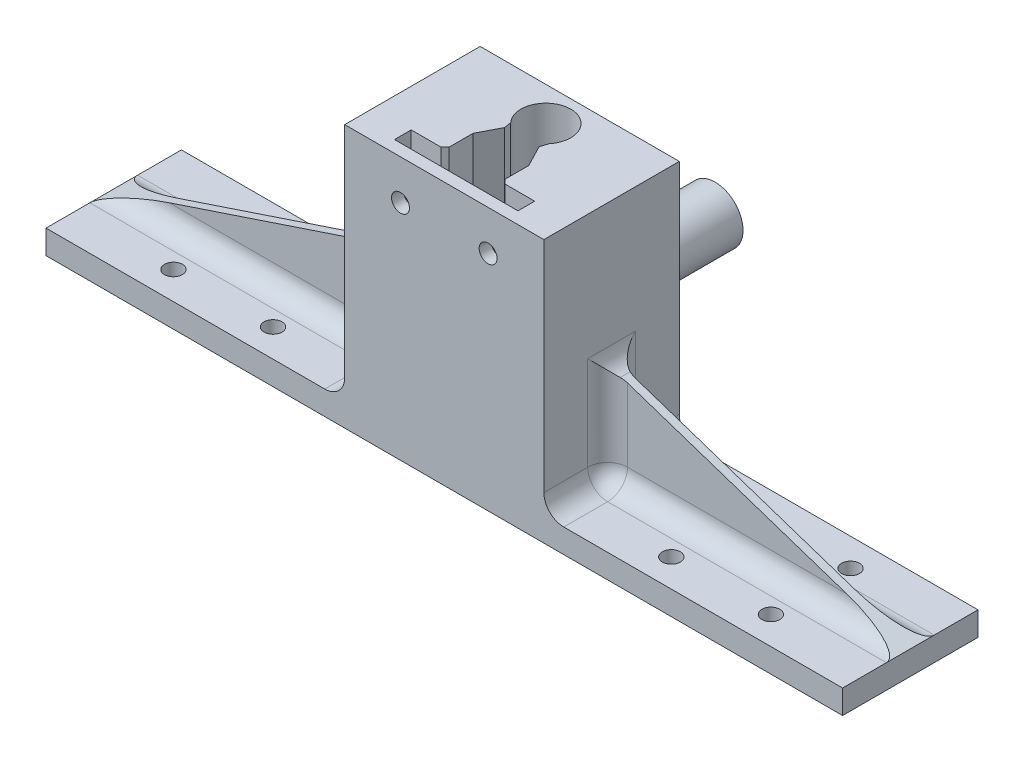
from build123d import *

# Parameters (mm, degrees)
SKETCH1_W               = 50
SKETCH1_H               = 34
BOSS_EXTRUDE1_DEPTH     = 60
CUT_EXTRUDE1_DEPTH      = 68.186308129
SKETCH3_R               = 2.25
CUT_EXTRUDE2_DEPTH      = 74.35529974
CUT_EXTRUDE3_DEPTH      = 24.8
CHAMFER1_SIZE           = 1
CHAMFER1_SIZE_2         = 1.220120443
SKETCH5_W               = 200
SKETCH5_H               = 34
BOSS_EXTRUDE2_DEPTH     = 6
BOSS_EXTRUDE3_DEPTH     = 1
FILLET1_R               = 5
FILLET2_R               = 5
SKETCH7_R               = 2.25
CUT_EXTRUDE4_DEPTH      = 4
SKETCH8_R               = 2.25
CUT_EXTRUDE5_DEPTH      = 119.882294729
LPATTERN1_COUNT         = 2
LPATTERN1_PITCH         = 25
MIRROR4_COPY_1_SKETCH_R = 2.25
MIRROR4_COPY_1_DEPTH    = 4
MIRROR4_COPY_2_SKETCH_R = 2.25
MIRROR4_COPY_2_DEPTH    = 119.882294729
CUT_EXTRUDE6_DEPTH      = 4
SKETCH10_R              = 7
BOSS_EXTRUDE4_DEPTH     = 14
SKETCH11_R              = 7
SKETCH11_R_2            = 4.15
BOSS_EXTRUDE5_DEPTH     = 20
CHAMFER2_SIZE           = 10
CHAMFER2_SIZE2          = 0.174550649
CHAMFER3_SIZE           = 10


with BuildPart() as part:
    # Sketch1 → Boss-Extrude1 (new body)
    with BuildSketch(Plane(origin=(0, 0, 0), x_dir=(1, 0, 0), z_dir=(0, 1, 0))):
        Rectangle(SKETCH1_W, SKETCH1_H)
    extrude(amount=BOSS_EXTRUDE1_DEPTH)

    # Sketch2 → Cut-Extrude1 (cut, through all)
    with BuildSketch(Plane(origin=(0, 60, 0), x_dir=(1, 0, 0), z_dir=(0, 1, 0))):
        with BuildLine():
            Line((-3.75, 3.5), (-7, -2.8))
            Line((-7, -2.8), (-7, -9.8))
            Line((-7, -9.8), (-15.5, -9.8))
            Line((-15.5, -9.8), (-15.5, -14))
            Line((-15.5, -14), (15.5, -14))
            Line((15.5, -14), (15.5, -9.8))
            Line((15.5, -9.8), (7, -9.8))
            Line((7, -9.8), (7, -2.8))
            Line((7, -2.8), (3.75, 3.5))
            ThreePointArc((3.75, 3.5), (0, 14.75), (-3.75, 3.5))
        make_face()
    extrude(amount=-CUT_EXTRUDE1_DEPTH, mode=Mode.SUBTRACT)

    # Sketch3 → Cut-Extrude2 (cut, through all)
    with BuildSketch(Plane.XY.offset(17)):
        with Locations((-11, 50)):
            Circle(SKETCH3_R)
        with Locations((11, 50)):
            Circle(SKETCH3_R)
    extrude(amount=-CUT_EXTRUDE2_DEPTH, mode=Mode.SUBTRACT)

    # Sketch4 → Cut-Extrude3 (cut)
    with BuildSketch(Plane(origin=(0, 0, -17), x_dir=(-1, 0, 0), z_dir=(0, 0, -1))):
        Polygon((14.75, 52.165063509), (11, 54.330127019), (7.25, 52.165063509), (7.25, 47.834936491), (11, 45.669872981), (14.75, 47.834936491), align=None)
        Polygon((-7.25, 47.834936491), (-7.25, 52.165063509), (-11, 54.330127019), (-14.75, 52.165063509), (-14.75, 47.834936491), (-11, 45.669872981), align=None)
    extrude(amount=-CUT_EXTRUDE3_DEPTH, mode=Mode.SUBTRACT)

    # Chamfer1
    # the kernel refuses this chamfer: 1.220120443, 1 mm, written as the material it takes off along each edge
    with BuildSketch(Plane(origin=(-7, 62.571682988, 9.8), x_dir=(-1, 0, 0), z_dir=(0, -1, 0)), Plane(origin=(7, 62.571682988, 9.8), x_dir=(0, 0, -1), z_dir=(0, -1, 0))) as chamfer1_piece_1:
        Polygon((CHAMFER1_SIZE, 0), (0, CHAMFER1_SIZE), (0, 0), align=None)
    extrude(amount=65.143365976, mode=Mode.SUBTRACT)
    with BuildSketch(Plane(origin=(-3.75, 63.150527813, -3.5), x_dir=(-0.45846324589157744, 0, 0.8887133689590581), z_dir=(0, -1, 0))) as chamfer1_piece_2:
        with BuildLine():
            Line((CHAMFER1_SIZE_2, 0), (-0.278286757, 1.065574765))
            ThreePointArc((-0.278286757, 1.065574765), (-0.120412167, 0.557139368), (0, 0))
            Line((0, 0), (CHAMFER1_SIZE_2, 0))
        make_face()
    extrude(amount=66.301055626, mode=Mode.SUBTRACT)
    with BuildSketch(Plane(origin=(3.75, 63.795705698, -3.5), x_dir=(0.7235959376340886, 0, -0.6902238180760238), z_dir=(0, -1, 0))) as chamfer1_piece_3:
        with BuildLine():
            Line((1.475268649, 0), (-CHAMFER1_SIZE * 0.281668992416, CHAMFER1_SIZE * 0.959511635527))
            Line((-CHAMFER1_SIZE * 0.281668992416, CHAMFER1_SIZE * 0.959511635527), (0, 0))
            ThreePointArc((0, 0), (0.759242358, 0.043643641), (1.475268649, 0))
        make_face()
    extrude(amount=67.591411396, mode=Mode.SUBTRACT)

    # Sketch5 → Boss-Extrude2 (add)
    with BuildSketch(Plane.XZ):
        Rectangle(SKETCH5_W, SKETCH5_H)
    extrude(amount=BOSS_EXTRUDE2_DEPTH)

    # Sketch6 → Boss-Extrude3 (add, symmetric)
    with BuildSketch(Plane.XY):
        Polygon((-100, 0), (-25, 25), (-25, 0), align=None)
    boss_extrude3 = extrude(amount=BOSS_EXTRUDE3_DEPTH, both=True)

    # Mirror3: Boss-Extrude3 across plane
    add(boss_extrude3.mirror(Plane(origin=(0, 0, 0), x_dir=(0, 0, 1), z_dir=(1, 0, 0))))

    # Fillet1
    # the kernel refuses this fillet: 5 mm, written as the material it adds along each edge
    with BuildSketch(Plane(origin=(-12.5, 0, -1), x_dir=(0, 0, -1), z_dir=(-1, 0, 0))) as fillet1_piece_1_section:
        with BuildLine():
            CenterArc((FILLET1_R, -FILLET1_R), FILLET1_R, 90, 90)
            Line((0, -FILLET1_R), (0, 0))
            Line((0, 0), (FILLET1_R, 0))
        make_face()
    fillet1_piece_1 = extrude(amount=87.5, mode=Mode.PRIVATE)
    fillet1_piece_1 = split(fillet1_piece_1, bisect_by=Plane(origin=(-21.25, 26.25, -1), z_dir=(0.31622776601683794, -0.9486832980505139, 0)), keep=Keep.TOP, mode=Mode.PRIVATE)
    add(fillet1_piece_1)
    with BuildSketch(Plane(origin=(-12.5, 0, 1), x_dir=(0, 0, 1), z_dir=(-1, 0, 0))) as fillet1_piece_2_section:
        with BuildLine():
            CenterArc((FILLET1_R, FILLET1_R), FILLET1_R, 180, 90)
            Line((0, FILLET1_R), (0, 0))
            Line((0, 0), (FILLET1_R, 0))
        make_face()
    fillet1_piece_2 = extrude(amount=87.5, mode=Mode.PRIVATE)
    fillet1_piece_2 = split(fillet1_piece_2, bisect_by=Plane(origin=(-21.25, 26.25, 1), z_dir=(0.31622776601683794, -0.9486832980505139, 0)), keep=Keep.TOP, mode=Mode.PRIVATE)
    add(fillet1_piece_2)
    with BuildSketch(Plane(origin=(12.5, 0, 1), x_dir=(0, 0, 1), z_dir=(1, 0, 0))) as fillet1_piece_3_section:
        with BuildLine():
            CenterArc((FILLET1_R, -FILLET1_R), FILLET1_R, 90, 90)
            Line((0, -FILLET1_R), (0, 0))
            Line((0, 0), (FILLET1_R, 0))
        make_face()
    fillet1_piece_3 = extrude(amount=87.5, mode=Mode.PRIVATE)
    fillet1_piece_3 = split(fillet1_piece_3, bisect_by=Plane(origin=(21.25, 26.25, 1), z_dir=(-0.31622776601683794, -0.9486832980505139, 0)), keep=Keep.TOP, mode=Mode.PRIVATE)
    add(fillet1_piece_3)
    with BuildSketch(Plane(origin=(12.5, 0, -1), x_dir=(0, 0, -1), z_dir=(1, 0, 0))) as fillet1_piece_4_section:
        with BuildLine():
            CenterArc((FILLET1_R, FILLET1_R), FILLET1_R, 180, 90)
            Line((0, FILLET1_R), (0, 0))
            Line((0, 0), (FILLET1_R, 0))
        make_face()
    fillet1_piece_4 = extrude(amount=87.5, mode=Mode.PRIVATE)
    fillet1_piece_4 = split(fillet1_piece_4, bisect_by=Plane(origin=(21.25, 26.25, -1), z_dir=(-0.31622776601683794, -0.9486832980505139, 0)), keep=Keep.TOP, mode=Mode.PRIVATE)
    add(fillet1_piece_4)

    # Fillet2
    fillet2_edges = [part.edges().sort_by_distance(p)[0] for p in [
        (-25, 25, 0),
        (25, 25, 0),
        (25, 15, -1),
        (25, 0, -11.5),
        (25, 15, 1),
        (25, 1.464466094, 2.464466094),
        (25, 1.464466094, -2.464466094),
        (-25, 15, -1),
        (-25, 15, 1),
        (-25, 0, 11.5),
        (-25, 1.464466094, 2.464466094),
        (-25, 1.464466094, -2.464466094),
        (25, 0, 11.5),
        (-25, 0, -11.5),
    ]]
    fillet(fillet2_edges, radius=FILLET2_R)

    # Sketch7 → Cut-Extrude4 (cut)
    with BuildSketch(Plane.XZ.offset(6)):
        with Locations(Location((-75, 10, 0), (0, 0, 270))):
            Circle(SKETCH7_R)
        with Locations(Location((-75, -10, 0), (0, 0, 270))):
            Circle(SKETCH7_R)
    cut_extrude4 = extrude(amount=-CUT_EXTRUDE4_DEPTH, mode=Mode.SUBTRACT)

    # Sketch8 → Cut-Extrude5 (cut, through all)
    with BuildSketch(Plane(origin=(0, -2, 0), x_dir=(-1, 0, 0), z_dir=(0, -1, 0))):
        with Locations(Location((75, -10, 0), (0, 0, 90))):
            Circle(SKETCH8_R)
        with Locations(Location((75, 10, 0), (0, 0, 90))):
            Circle(SKETCH8_R)
    cut_extrude5 = extrude(amount=-CUT_EXTRUDE5_DEPTH, mode=Mode.SUBTRACT)

    # LPattern1: Cut-Extrude4, Cut-Extrude5 ×2
    with Locations(*[(i * LPATTERN1_PITCH, 0, 0) for i in range(1, LPATTERN1_COUNT)]):
        add(cut_extrude4, mode=Mode.SUBTRACT)
        add(cut_extrude5, mode=Mode.SUBTRACT)

    # Mirror4: Cut-Extrude4, Cut-Extrude5 across plane
    add(cut_extrude4.mirror(Plane(origin=(0, 0, 0), x_dir=(0, 0, 1), z_dir=(1, 0, 0))), mode=Mode.SUBTRACT)
    add(cut_extrude5.mirror(Plane(origin=(0, 0, 0), x_dir=(0, 0, 1), z_dir=(1, 0, 0))), mode=Mode.SUBTRACT)

    # Mirror4 copy 1 sketch → Mirror4 copy 1 (cut)
    with BuildSketch(Plane(origin=(-25, -6, 0), x_dir=(-1, 0, 0), z_dir=(0, -1, 0))):
        with Locations((-75, -10)):
            Circle(MIRROR4_COPY_1_SKETCH_R)
        with Locations((-75, 10)):
            Circle(MIRROR4_COPY_1_SKETCH_R)
    extrude(amount=-MIRROR4_COPY_1_DEPTH, mode=Mode.SUBTRACT)

    # Mirror4 copy 2 sketch → Mirror4 copy 2 (cut, through all)
    with BuildSketch(Plane(origin=(-25, -2, 0), x_dir=(1, 0, 0), z_dir=(0, -1, 0))):
        with Locations((75, 10)):
            Circle(MIRROR4_COPY_2_SKETCH_R)
        with Locations((75, -10)):
            Circle(MIRROR4_COPY_2_SKETCH_R)
    extrude(amount=-MIRROR4_COPY_2_DEPTH, mode=Mode.SUBTRACT)

    # Sketch9 → Cut-Extrude6 (cut)
    with BuildSketch(Plane(origin=(0, 0, 0), x_dir=(1, 0, 0), z_dir=(0, 1, 0))):
        with BuildLine():
            Line((4.208463246, 2.611286631), (4.817498401, 4.518265559))
            ThreePointArc((4.817498401, 4.518265559), (-0.187957188, 14.747173128), (-4.56940629, 4.235844027))
            Line((-4.56940629, 4.235844027), (-4.309380379, 2.415662651))
            Line((-4.309380379, 2.415662651), (-7, -2.8))
            Line((-7, -2.8), (-7, -8.8))
            Line((-7, -8.8), (-8, -9.8))
            Line((-8, -9.8), (-15.5, -9.8))
            Line((-15.5, -9.8), (-15.5, -14))
            Line((-15.5, -14), (15.5, -14))
            Line((15.5, -14), (15.5, -9.8))
            Line((15.5, -9.8), (8, -9.8))
            Line((8, -9.8), (7, -8.8))
            Line((7, -8.8), (7, -2.8))
            Line((7, -2.8), (4.208463246, 2.611286631))
        make_face()
    extrude(amount=-CUT_EXTRUDE6_DEPTH, mode=Mode.SUBTRACT)

    # Sketch10 → Boss-Extrude4 (add)
    with BuildSketch(Plane(origin=(0, 0, -17), x_dir=(-1, 0, 0), z_dir=(0, 0, -1))):
        with Locations(Location((0, 19, 0), (0, 0, 180))):
            Circle(SKETCH10_R)
    extrude(amount=BOSS_EXTRUDE4_DEPTH)

    # Sketch11 → Boss-Extrude5 (add)
    with BuildSketch(Plane(origin=(0, 0, -31), x_dir=(-1, 0, 0), z_dir=(0, 0, -1))):
        with Locations(Location((0, 19, 0), (0, 0, 180))):
            Circle(SKETCH11_R)
        with Locations((0, 19)):
            Circle(SKETCH11_R_2, mode=Mode.SUBTRACT)
    extrude(amount=BOSS_EXTRUDE5_DEPTH)

    # Chamfer2
    chamfer2_edges = [part.edges().sort_by_distance(p)[0] for p in [
        (4.15, 19, -31),
    ]]
    chamfer2_side = [part.faces().sort_by_distance(p)[0] for p in [
        (4.15, 19, -41),
    ]]
    chamfer(chamfer2_edges, length=CHAMFER2_SIZE, length2=CHAMFER2_SIZE2, reference=chamfer2_side[0])

    # Chamfer3
    chamfer3_edges = [part.edges().sort_by_distance(p)[0] for p in [
        (-7, 19, -17),
    ]]
    chamfer(chamfer3_edges, length=CHAMFER3_SIZE)


solid = part.part
